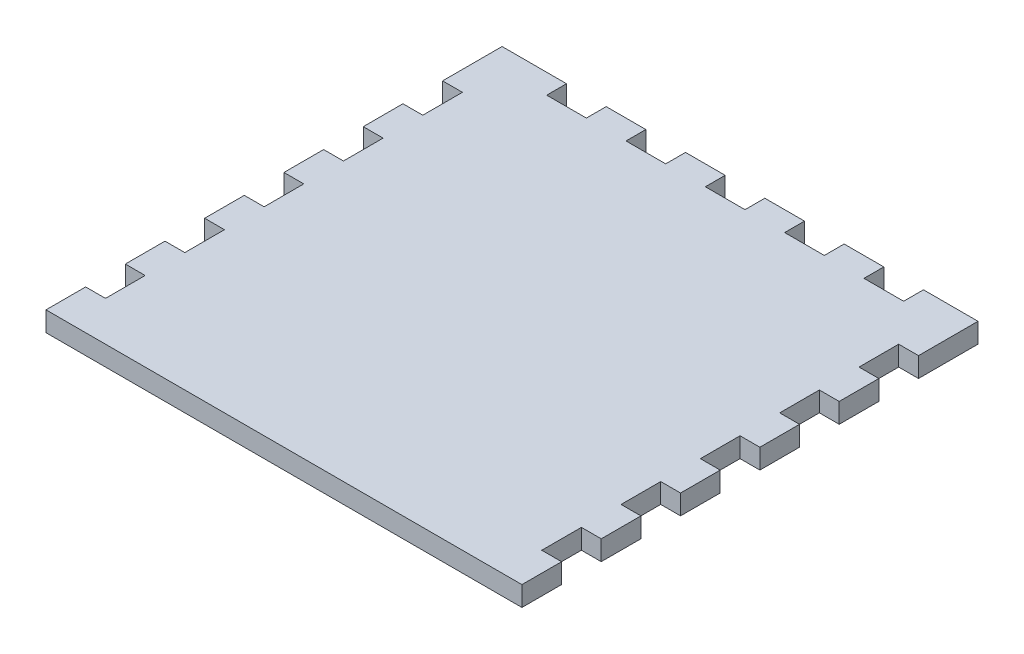
from build123d import *

# Parameters (mm, degrees)
SKETCH1_W               = 279.4
SKETCH1_H               = 279.4
BOSS_EXTRUDE1_DEPTH     = 12.7
SKETCH2_W               = 25.4
SKETCH2_H               = 12.7
BOSS_EXTRUDE2_DEPTH     = 12.7
LPATTERN1_COUNT         = 6
LPATTERN1_PITCH         = 50.8
MIRROR1_COPY_1_SKETCH_W = 25.4
MIRROR1_COPY_1_SKETCH_H = 12.7
MIRROR1_COPY_1_DEPTH    = 12.7
MIRROR1_COPY_2_SKETCH_W = 25.4
MIRROR1_COPY_2_SKETCH_H = 12.7
MIRROR1_COPY_2_DEPTH    = 12.7
MIRROR1_COPY_3_SKETCH_W = 25.4
MIRROR1_COPY_3_SKETCH_H = 12.7
MIRROR1_COPY_3_DEPTH    = 12.7
MIRROR1_COPY_4_SKETCH_W = 25.4
MIRROR1_COPY_4_SKETCH_H = 12.7
MIRROR1_COPY_4_DEPTH    = 12.7
MIRROR1_COPY_5_SKETCH_W = 25.4
MIRROR1_COPY_5_SKETCH_H = 12.7
MIRROR1_COPY_5_DEPTH    = 12.7
MIRROR1_COPY_6_SKETCH_W = 25.4
MIRROR1_COPY_6_SKETCH_H = 12.7
MIRROR1_COPY_6_DEPTH    = 12.7
SKETCH3_W               = 25.4
SKETCH3_H               = 12.7
BOSS_EXTRUDE3_DEPTH     = 12.7
LPATTERN2_COUNT         = 6
LPATTERN2_PITCH         = 50.8
SKETCH5_W               = 25.4
SKETCH5_H               = 12.7
BOSS_EXTRUDE4_DEPTH     = 12.7


with BuildPart() as part:
    # Sketch1 → Boss-Extrude1 (new body)
    with BuildSketch(Plane(origin=(0, 0, 0), x_dir=(1, 0, 0), z_dir=(0, 1, 0))):
        Rectangle(SKETCH1_W, SKETCH1_H)
    extrude(amount=BOSS_EXTRUDE1_DEPTH)

    # Sketch2 → Boss-Extrude2 (add)
    with BuildSketch(Plane(origin=(139.7, 0, 0), x_dir=(0, 0, -1), z_dir=(1, 0, 0))):
        with Locations((-127, 6.35)):
            Rectangle(SKETCH2_W, SKETCH2_H)
    boss_extrude2 = extrude(amount=BOSS_EXTRUDE2_DEPTH)

    # LPattern1: Boss-Extrude2 ×6
    with Locations(*[(0, 0, -i * LPATTERN1_PITCH) for i in range(1, LPATTERN1_COUNT)]):
        add(boss_extrude2)

    # Mirror1 copy 1 sketch → Mirror1 copy 1 (add)
    with BuildSketch(Plane(origin=(-139.7, 0, -50.8), x_dir=(0, 0, -1), z_dir=(-1, 0, 0))):
        with Locations((-127, -6.35)):
            Rectangle(MIRROR1_COPY_1_SKETCH_W, MIRROR1_COPY_1_SKETCH_H)
    extrude(amount=MIRROR1_COPY_1_DEPTH)

    # Mirror1 copy 2 sketch → Mirror1 copy 2 (add)
    with BuildSketch(Plane(origin=(-139.7, 0, -101.6), x_dir=(0, 0, -1), z_dir=(-1, 0, 0))):
        with Locations((-127, -6.35)):
            Rectangle(MIRROR1_COPY_2_SKETCH_W, MIRROR1_COPY_2_SKETCH_H)
    extrude(amount=MIRROR1_COPY_2_DEPTH)

    # Mirror1 copy 3 sketch → Mirror1 copy 3 (add)
    with BuildSketch(Plane(origin=(-139.7, 0, -152.4), x_dir=(0, 0, -1), z_dir=(-1, 0, 0))):
        with Locations((-127, -6.35)):
            Rectangle(MIRROR1_COPY_3_SKETCH_W, MIRROR1_COPY_3_SKETCH_H)
    extrude(amount=MIRROR1_COPY_3_DEPTH)

    # Mirror1 copy 4 sketch → Mirror1 copy 4 (add)
    with BuildSketch(Plane(origin=(-139.7, 0, -203.2), x_dir=(0, 0, -1), z_dir=(-1, 0, 0))):
        with Locations((-127, -6.35)):
            Rectangle(MIRROR1_COPY_4_SKETCH_W, MIRROR1_COPY_4_SKETCH_H)
    extrude(amount=MIRROR1_COPY_4_DEPTH)

    # Mirror1 copy 5 sketch → Mirror1 copy 5 (add)
    with BuildSketch(Plane(origin=(-139.7, 0, -254), x_dir=(0, 0, -1), z_dir=(-1, 0, 0))):
        with Locations((-127, -6.35)):
            Rectangle(MIRROR1_COPY_5_SKETCH_W, MIRROR1_COPY_5_SKETCH_H)
    extrude(amount=MIRROR1_COPY_5_DEPTH)

    # Mirror1 copy 6 sketch → Mirror1 copy 6 (add)
    with BuildSketch(Plane(origin=(-139.7, 0, 0), x_dir=(0, 0, -1), z_dir=(-1, 0, 0))):
        with Locations((-127, -6.35)):
            Rectangle(MIRROR1_COPY_6_SKETCH_W, MIRROR1_COPY_6_SKETCH_H)
    extrude(amount=MIRROR1_COPY_6_DEPTH)

    # Sketch3 → Boss-Extrude3 (add)
    with BuildSketch(Plane(origin=(0, 0, -139.7), x_dir=(-1, 0, 0), z_dir=(0, 0, -1))):
        with Locations((-130.175, 6.35)):
            Rectangle(SKETCH3_W, SKETCH3_H)
    boss_extrude3 = extrude(amount=BOSS_EXTRUDE3_DEPTH)

    # LPattern2: Boss-Extrude3 ×6
    with Locations(*[(-i * LPATTERN2_PITCH, 0, 0) for i in range(1, LPATTERN2_COUNT)]):
        add(boss_extrude3)

    # Sketch5 → Boss-Extrude4 (add)
    with BuildSketch(Plane(origin=(0, 0, -139.7), x_dir=(-1, 0, 0), z_dir=(0, 0, -1))):
        with Locations((-139.7, 6.35)):
            Rectangle(SKETCH5_W, SKETCH5_H)
    boss_extrude4 = extrude(amount=BOSS_EXTRUDE4_DEPTH)

    # Mirror2: Boss-Extrude4 across plane
    add(boss_extrude4.mirror(Plane(origin=(0, 0, 0), x_dir=(0, 0, 1), z_dir=(1, 0, 0))))


solid = part.part
